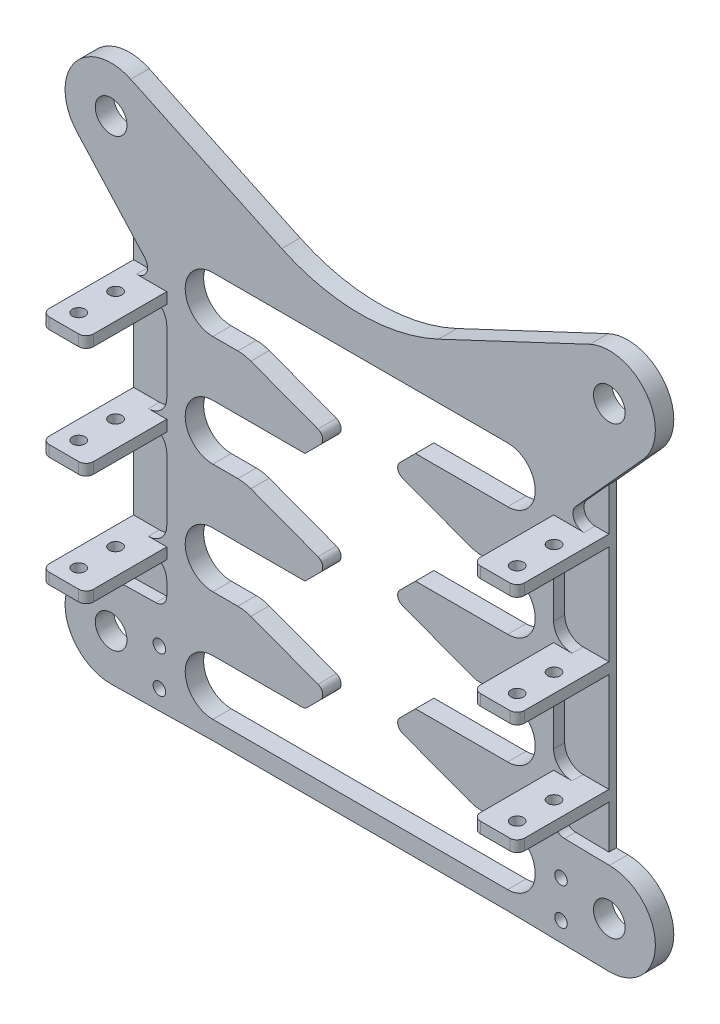
from build123d import *

# Parameters (mm, degrees)
SKETCH2_W               = 5
SKETCH2_H               = 5
BOSS_EXTRUDE2_DEPTH     = 5
CHAMFER1_SIZE           = 7.5
CHAMFER2_SIZE           = 5
FILLET2_R               = 1.5
SKETCH3_R               = 12.5
SKETCH3_R_2             = 4.3
BOSS_EXTRUDE3_DEPTH     = 5
FILLET3_R               = 50
BOSS_EXTRUDE4_DEPTH     = 5
BOSS_EXTRUDE5_START     = -5
BOSS_EXTRUDE5_DEPTH     = 5
SKETCH7_W               = 1
SKETCH7_H               = 1
BOSS_EXTRUDE6_DEPTH     = 5
SKETCH8_R               = 1.7
CUT_EXTRUDE1_DEPTH      = 10
SKETCH9_R               = 1.7
CUT_EXTRUDE2_DEPTH      = 10
CUT_EXTRUDE3_DEPTH      = 10
FILLET4_R               = 10
FILLET5_R               = 2
SKETCH12_W              = 26.9
SKETCH12_H              = 3
BOSS_EXTRUDE7_DEPTH     = 12
SKETCH13_W              = 2
SKETCH13_H              = 74.806601718
BOSS_EXTRUDE8_DEPTH     = 12
SKETCH14_W              = 10.537414104
SKETCH14_H              = 2
BOSS_EXTRUDE9_DEPTH     = 20
FILLET6_R               = 3
FILLET7_R               = 5
CUT_EXTRUDE4_DEPTH      = 155.693359215
CUT_EXTRUDE4_DEPTH_BACK = 155.693359215
SKETCH15_R              = 1.7
SKETCH16_W              = 2
SKETCH16_H              = 25.319284644
SKETCH16_H_2            = 27
SKETCH16_H_3            = 11.529384317
SKETCH16_H_4            = 3
SKETCH16_W_2            = 3
SKETCH16_W_3            = 21.9
SKETCH16_H_5            = 1.383773351
SKETCH16_H_6            = 1.616226649
BOSS_EXTRUDE13_DEPTH    = 12
SKETCH17_W              = 12
SKETCH17_H              = 2
BOSS_EXTRUDE14_DEPTH    = 2
FILLET8_R               = 5
FILLET9_R               = 3
CUT_EXTRUDE5_DEPTH      = 155.693359215
CUT_EXTRUDE5_DEPTH_BACK = 155.693359215
SKETCH19_R              = 1.7
FILLET10_R              = 2
CUT_EXTRUDE6_DEPTH      = 158.435862622
CUT_EXTRUDE6_DEPTH_BACK = 158.435862622
SKETCH20_W              = 1
SKETCH20_H              = 5


# Some blends are built 0.0001 mm under size
with BuildPart() as part:
    # Sketch2 → Boss-Extrude2 (new body)
    with BuildSketch(Plane.XY.offset(60)):
        with BuildLine():
            Line((12.5, 74.5), (12.5, 69.5))
            Line((12.5, 69.5), (40, 69.5))
            ThreePointArc((40, 69.5), (52.5, 82), (40, 94.5))
            Line((40, 94.5), (-6e-08, 94.5))
            ThreePointArc((-6e-08, 94.5), (5.590169917, 93.180339901), (10, 89.5))
            Line((10, 89.5), (40, 89.5))
            ThreePointArc((40, 89.5), (47.5, 82), (40, 74.5))
            Line((40, 74.5), (12.5, 74.5))
        make_face()
        with BuildLine():
            Line((40, 44.5), (12.5, 44.5))
            Line((12.5, 44.5), (12.5, 39.5))
            Line((12.5, 39.5), (40, 39.5))
            ThreePointArc((40, 39.5), (52.5, 52), (40, 64.5))
            Line((40, 64.5), (12.5, 64.5))
            Line((12.5, 64.5), (12.5, 59.5))
            Line((12.5, 59.5), (40, 59.5))
            ThreePointArc((40, 59.5), (47.5, 52), (40, 44.5))
        make_face()
        with BuildLine():
            Line((40, 34.5), (12.5, 34.5))
            Line((12.5, 34.5), (12.5, 29.5))
            Line((12.5, 29.5), (40, 29.5))
            ThreePointArc((40, 29.5), (47.5, 22), (40, 14.5))
            Line((40, 14.5), (12.5, 14.5))
            Line((12.5, 14.5), (12.5, 9.5))
            Line((12.5, 9.5), (40, 9.5))
            ThreePointArc((40, 9.5), (52.5, 22), (40, 34.5))
        make_face()
        with BuildLine():
            Line((40, 4.5), (12.5, 4.5))
            Line((12.5, 4.5), (12.5, -0.5))
            Line((12.5, -0.5), (40, -0.5))
            ThreePointArc((40, -0.5), (47.5, -8), (40, -15.5))
            Line((40, -15.5), (10, -15.5))
            ThreePointArc((10, -15.5), (5.590169951, -19.180339884), (1.6e-08, -20.5))
            Line((1.6e-08, -20.5), (40, -20.5))
            ThreePointArc((40, -20.5), (52.5, -8), (40, 4.5))
        make_face()
        with Locations((10, 2)):
            Rectangle(SKETCH2_W, SKETCH2_H)
        with Locations((10, 7)):
            Rectangle(SKETCH2_W, SKETCH2_H)
        with Locations((10, 12)):
            Rectangle(SKETCH2_W, SKETCH2_H)
        with Locations((10, 32)):
            Rectangle(SKETCH2_W, SKETCH2_H)
        with Locations((10, 37)):
            Rectangle(SKETCH2_W, SKETCH2_H)
        with Locations((10, 42)):
            Rectangle(SKETCH2_W, SKETCH2_H)
        with Locations((10, 62)):
            Rectangle(SKETCH2_W, SKETCH2_H)
        with Locations((10, 67)):
            Rectangle(SKETCH2_W, SKETCH2_H)
        with Locations((10, 72)):
            Rectangle(SKETCH2_W, SKETCH2_H)
        with BuildLine():
            Line((-10, 89.5), (9.8e-08, 89.5))
            Line((9.8e-08, 89.5), (10, 89.5))
            ThreePointArc((10, 89.5), (5.590169917, 93.180339901), (-6e-08, 94.5))
            ThreePointArc((-6e-08, 94.5), (-5.59016997, 93.180339874), (-10, 89.5))
        make_face()
        with BuildLine():
            Line((1.6e-08, -15.5), (-10, -15.5))
            ThreePointArc((-10, -15.5), (-5.590169937, -19.180339891), (1.6e-08, -20.5))
            ThreePointArc((1.6e-08, -20.5), (5.590169951, -19.180339884), (10, -15.5))
            Line((10, -15.5), (1.6e-08, -15.5))
        make_face()
        with BuildLine():
            Line((-12.5, -0.5), (-12.5, 4.5))
            Line((-12.5, 4.5), (-40, 4.5))
            ThreePointArc((-40, 4.5), (-52.5, -8), (-40, -20.5))
            Line((-40, -20.5), (1.6e-08, -20.5))
            ThreePointArc((1.6e-08, -20.5), (-5.590169937, -19.180339891), (-10, -15.5))
            Line((-10, -15.5), (-40, -15.5))
            ThreePointArc((-40, -15.5), (-47.5, -8), (-40, -0.5))
            Line((-40, -0.5), (-12.5, -0.5))
        make_face()
        with Locations((-10, 2)):
            Rectangle(SKETCH2_W, SKETCH2_H)
        with Locations((-10, 7)):
            Rectangle(SKETCH2_W, SKETCH2_H)
        with Locations((-10, 12)):
            Rectangle(SKETCH2_W, SKETCH2_H)
        with BuildLine():
            Line((-12.5, 29.5), (-12.5, 34.5))
            Line((-12.5, 34.5), (-40, 34.5))
            ThreePointArc((-40, 34.5), (-52.5, 22), (-40, 9.5))
            Line((-40, 9.5), (-12.5, 9.5))
            Line((-12.5, 9.5), (-12.5, 14.5))
            Line((-12.5, 14.5), (-40, 14.5))
            ThreePointArc((-40, 14.5), (-47.5, 22), (-40, 29.5))
            Line((-40, 29.5), (-12.5, 29.5))
        make_face()
        with Locations((-10, 32)):
            Rectangle(SKETCH2_W, SKETCH2_H)
        with Locations((-10, 37)):
            Rectangle(SKETCH2_W, SKETCH2_H)
        with Locations((-10, 42)):
            Rectangle(SKETCH2_W, SKETCH2_H)
        with BuildLine():
            Line((-12.5, 39.5), (-12.5, 44.5))
            Line((-12.5, 44.5), (-40, 44.5))
            ThreePointArc((-40, 44.5), (-47.5, 52), (-40, 59.5))
            Line((-40, 59.5), (-12.5, 59.5))
            Line((-12.5, 59.5), (-12.5, 64.5))
            Line((-12.5, 64.5), (-40, 64.5))
            ThreePointArc((-40, 64.5), (-52.5, 52), (-40, 39.5))
            Line((-40, 39.5), (-12.5, 39.5))
        make_face()
        with Locations((-10, 62)):
            Rectangle(SKETCH2_W, SKETCH2_H)
        with Locations((-10, 67)):
            Rectangle(SKETCH2_W, SKETCH2_H)
        with Locations((-10, 72)):
            Rectangle(SKETCH2_W, SKETCH2_H)
        with BuildLine():
            Line((-40, 69.5), (-12.5, 69.5))
            Line((-12.5, 69.5), (-12.5, 74.5))
            Line((-12.5, 74.5), (-40, 74.5))
            ThreePointArc((-40, 74.5), (-47.5, 82), (-40, 89.5))
            Line((-40, 89.5), (-10, 89.5))
            ThreePointArc((-10, 89.5), (-5.59016997, 93.180339874), (-6e-08, 94.5))
            Line((-6e-08, 94.5), (-40, 94.5))
            ThreePointArc((-40, 94.5), (-52.5, 82), (-40, 69.5))
        make_face()
    extrude(amount=BOSS_EXTRUDE2_DEPTH)

    # Chamfer1
    chamfer1_edges = [part.edges().sort_by_distance(p)[0] for p in [
        (7.5, 44.5, 62.5),
        (-7.5, 44.5, 62.5),
        (-7.5, 14.5, 62.5),
        (7.5, 14.5, 62.5),
        (-7.5, 29.5, 62.5),
        (-7.5, -0.5, 62.5),
        (7.5, -0.5, 62.5),
        (7.5, 29.5, 62.5),
        (-7.5, 74.5, 62.5),
        (-7.5, 59.5, 62.5),
        (7.5, 74.5, 62.5),
        (7.5, 59.5, 62.5),
    ]]
    chamfer(chamfer1_edges, length=CHAMFER1_SIZE - 0.0001)  # a hair under: the kernel refuses the full size

    # Chamfer2
    # the kernel refuses this chamfer: 5 mm, written as the material it adds along each edge
    with BuildSketch(Plane(origin=(12.5, 64.5, 60), x_dir=(0.9996219169112968, -0.0274958766105877, 0), z_dir=(0, 0, 1)), Plane(origin=(12.5, 69.5, 60), x_dir=(-0.027495876610586282, -0.9996219169112968, 0), z_dir=(0, 0, 1)), Plane(origin=(12.5, 34.5, 60), x_dir=(0.9996219169112968, -0.027495876610586317, 0), z_dir=(0, 0, 1)), Plane(origin=(12.5, 39.5, 60), x_dir=(-0.027495876610586317, -0.9996219169112968, 0), z_dir=(0, 0, 1)), Plane(origin=(-12.5, 64.5, 60), x_dir=(0.027495876610586282, 0.9996219169112968, 0), z_dir=(0, 0, 1)), Plane(origin=(-12.5, 69.5, 60), x_dir=(-0.9996219169112965, 0.02749587661059046, 0), z_dir=(0, 0, 1)), Plane(origin=(-12.5, 39.5, 60), x_dir=(-0.9996219169112968, 0.027495876610586317, 0), z_dir=(0, 0, 1)), Plane(origin=(-12.5, 34.5, 60), x_dir=(0.027495876610586317, 0.9996219169112968, 0), z_dir=(0, 0, 1)), Plane(origin=(-12.5, 4.5, 60), x_dir=(0.027495876610586317, 0.9996219169112968, 0), z_dir=(0, 0, 1)), Plane(origin=(-12.5, 9.5, 60), x_dir=(-0.9996219169112968, 0.027495876610585973, 0), z_dir=(0, 0, 1)), Plane(origin=(12.5, 9.5, 60), x_dir=(-0.027495876610586317, -0.9996219169112968, 0), z_dir=(0, 0, 1)), Plane(origin=(12.5, 4.5, 60), x_dir=(0.9996219169112968, -0.027495876610586147, 0), z_dir=(0, 0, 1))) as chamfer2_piece_1:
        Polygon((CHAMFER2_SIZE * 0.999621916911, CHAMFER2_SIZE * 0.0274958766106), (-CHAMFER2_SIZE * 0.0274958766106, CHAMFER2_SIZE * 0.999621916911), (0, 0), align=None)
    extrude(amount=5)

    # Fillet2
    fillet2_edges = [part.edges().sort_by_distance(p)[0] for p in [
        (17.5, 64.5, 62.5),
        (17.5, 69.5, 62.5),
        (17.5, 34.5, 62.5),
        (17.5, 39.5, 62.5),
        (-17.5, 64.5, 62.5),
        (-17.5, 69.5, 62.5),
        (-17.5, 39.5, 62.5),
        (-17.5, 34.5, 62.5),
        (-17.5, 4.5, 62.5),
        (-17.5, 9.5, 62.5),
        (17.5, 9.5, 62.5),
        (17.5, 4.5, 62.5),
        (15, 67, 62.5),
        (15, 37, 62.5),
        (-15, 67, 62.5),
        (-15, 37, 62.5),
        (-15, 7, 62.5),
        (15, 7, 62.5),
    ]]
    fillet(fillet2_edges, radius=FILLET2_R)

    # Sketch3 → Boss-Extrude3 (add)
    # profile 1 of 8: a face of its own
    with BuildSketch(Plane(origin=(0, 0, 60), x_dir=(-1, 0, 0), z_dir=(0, 0, -1))):
        with BuildLine():
            Line((0, 94.5), (-62.283149796, 123.816370046))
            ThreePointArc((-62.283149796, 123.816370046), (-57.052144152, 119.203871721), (-55.106601718, 112.506601718))
            ThreePointArc((-55.106601718, 112.506601718), (-63.112426598, 100.842451942), (-76.874984117, 104.119284644))
            Line((-76.874984117, 104.119284644), (-49.268382399, 73.612682926))
            ThreePointArc((-49.268382399, 73.612682926), (-51.425661106, 87.0699377), (-40, 94.5))
            Line((-40, 94.5), (0, 94.5))
        make_face()
    # profile 2 of 8: a face of its own
    with BuildSketch(Plane(origin=(0, 0, 60), x_dir=(-1, 0, 0), z_dir=(0, 0, -1))):
        with Locations((-67.606601718, 112.506601718)):
            Circle(SKETCH3_R)
        with Locations((-67.606601718, 112.506601718)):
            Circle(SKETCH3_R_2, mode=Mode.SUBTRACT)
    # profile 3 of 8: a face of its own
    with BuildSketch(Plane(origin=(0, 0, 60), x_dir=(-1, 0, 0), z_dir=(0, 0, -1))):
        with BuildLine():
            Line((62.283149796, 123.816370046), (0, 94.5))
            Line((0, 94.5), (40, 94.5))
            ThreePointArc((40, 94.5), (51.425661106, 87.0699377), (49.268382399, 73.612682926))
            Line((49.268382399, 73.612682926), (76.874984117, 104.119284644))
            ThreePointArc((76.874984117, 104.119284644), (57.562478438, 105.065796147), (62.283149796, 123.816370046))
        make_face()
    # profile 4 of 8: a face of its own
    with BuildSketch(Plane(origin=(0, 0, 60), x_dir=(-1, 0, 0), z_dir=(0, 0, -1))):
        with Locations((67.606601718, 112.506601718)):
            Circle(SKETCH3_R)
        with Locations((67.606601718, 112.506601718)):
            Circle(SKETCH3_R_2, mode=Mode.SUBTRACT)
    # profile 5 of 8: a face of its own
    with BuildSketch(Plane(origin=(0, 0, 60), x_dir=(-1, 0, 0), z_dir=(0, 0, -1))):
        with BuildLine():
            Line((67.147987523, -20.998185805), (67.606601718, -21.006601718))
            ThreePointArc((67.606601718, -21.006601718), (76.445436483, -17.345436483), (80.106601718, -8.506601718))
            ThreePointArc((80.106601718, -8.506601718), (76.445436483, 0.332233047), (67.606601718, 3.993398282))
            ThreePointArc((67.606601718, 3.993398282), (55.108705873, -8.277256014), (67.147987523, -20.998185805))
        make_face()
        with Locations((67.606601718, -8.506601718)):
            Circle(SKETCH3_R_2, mode=Mode.SUBTRACT)
    # profile 6 of 8: a face of its own
    with BuildSketch(Plane(origin=(0, 0, 60), x_dir=(-1, 0, 0), z_dir=(0, 0, -1))):
        with BuildLine():
            Line((40, -20.5), (67.147987523, -20.998185805))
            ThreePointArc((67.147987523, -20.998185805), (55.108705873, -8.277256014), (67.606601718, 3.993398282))
            Line((67.606601718, 3.993398282), (40.458614195, 4.491584088))
            ThreePointArc((40.458614195, 4.491584088), (52.497895845, -8.229345704), (40, -20.5))
        make_face()
    # profile 7 of 8: a face of its own
    with BuildSketch(Plane(origin=(0, 0, 60), x_dir=(-1, 0, 0), z_dir=(0, 0, -1))):
        with BuildLine():
            ThreePointArc((-67.606601718, 3.993398282), (-80.106601718, -8.506601718), (-67.606601718, -21.006601718))
            Line((-67.606601718, -21.006601718), (-67.147987523, -20.998185805))
            ThreePointArc((-67.147987523, -20.998185805), (-58.607082913, -17.181776718), (-55.106601718, -8.506601718))
            ThreePointArc((-55.106601718, -8.506601718), (-58.767766953, 0.332233047), (-67.606601718, 3.993398282))
        make_face()
        with Locations((-67.606601718, -8.506601718)):
            Circle(SKETCH3_R_2, mode=Mode.SUBTRACT)
    # profile 8 of 8: a face of its own
    with BuildSketch(Plane(origin=(0, 0, 60), x_dir=(-1, 0, 0), z_dir=(0, 0, -1))):
        with BuildLine():
            ThreePointArc((-55.106601718, -8.506601718), (-58.607082913, -17.181776718), (-67.147987523, -20.998185805))
            Line((-67.147987523, -20.998185805), (-40, -20.5))
            ThreePointArc((-40, -20.5), (-52.497895845, -8.229345704), (-40.458614195, 4.491584088))
            Line((-40.458614195, 4.491584088), (-67.606601718, 3.993398282))
            ThreePointArc((-67.606601718, 3.993398282), (-58.767766953, 0.332233047), (-55.106601718, -8.506601718))
        make_face()
    extrude(amount=-BOSS_EXTRUDE3_DEPTH)

    # Fillet3
    fillet3_edges = [part.edges().sort_by_distance(p)[0] for p in [
        (0, 94.5, 62.5),
    ]]
    fillet(fillet3_edges, radius=FILLET3_R)

    # Sketch4 → Boss-Extrude4 (add)
    with BuildSketch(Plane.XY.offset(65)):
        with BuildLine():
            Line((-16.060660172, 8.060660172), (-17.060660172, 9.060660172))
            ThreePointArc((-17.060660172, 9.060660172), (-17.547295195, 9.385819299), (-18.121320344, 9.5))
            Line((-18.121320344, 9.5), (-40, 9.5))
            ThreePointArc((-40, 9.5), (-48.838834765, 13.161165235), (-52.5, 22))
            Line((-52.5, 22), (-52.5, 4.270615683))
            Line((-52.5, 4.270615683), (-40.458614195, 4.491584088))
            ThreePointArc((-40.458614195, 4.491584088), (-40.229345704, 4.497895845), (-40, 4.5))
            Line((-40, 4.5), (-18.121320344, 4.5))
            ThreePointArc((-18.121320344, 4.5), (-17.547295195, 4.614180701), (-17.060660172, 4.939339828))
            Line((-17.060660172, 4.939339828), (-16.060660172, 5.939339828))
            ThreePointArc((-16.060660172, 5.939339828), (-15.621320344, 7), (-16.060660172, 8.060660172))
        make_face()
        with BuildLine():
            Line((-52.5, 52), (-52.5, 22))
            ThreePointArc((-52.5, 22), (-48.838834765, 30.838834765), (-40, 34.5))
            Line((-40, 34.5), (-18.121320344, 34.5))
            ThreePointArc((-18.121320344, 34.5), (-17.547295195, 34.614180701), (-17.060660172, 34.939339828))
            Line((-17.060660172, 34.939339828), (-16.060660172, 35.939339828))
            ThreePointArc((-16.060660172, 35.939339828), (-15.621320344, 37), (-16.060660172, 38.060660172))
            Line((-16.060660172, 38.060660172), (-17.060660172, 39.060660172))
            ThreePointArc((-17.060660172, 39.060660172), (-17.547295195, 39.385819299), (-18.121320344, 39.5))
            Line((-18.121320344, 39.5), (-40, 39.5))
            ThreePointArc((-40, 39.5), (-48.838834765, 43.161165235), (-52.5, 52))
        make_face()
        with BuildLine():
            Line((-52.5, 77.183773351), (-52.5, 52))
            ThreePointArc((-52.5, 52), (-48.838834765, 60.838834765), (-40, 64.5))
            Line((-40, 64.5), (-18.121320344, 64.5))
            ThreePointArc((-18.121320344, 64.5), (-17.547295195, 64.614180701), (-17.060660172, 64.939339828))
            Line((-17.060660172, 64.939339828), (-16.060660172, 65.939339828))
            ThreePointArc((-16.060660172, 65.939339828), (-15.621320344, 67), (-16.060660172, 68.060660172))
            Line((-16.060660172, 68.060660172), (-17.060660172, 69.060660172))
            ThreePointArc((-17.060660172, 69.060660172), (-17.547295195, 69.385819299), (-18.121320344, 69.5))
            Line((-18.121320344, 69.5), (-40, 69.5))
            ThreePointArc((-40, 69.5), (-45.0699377, 70.574338894), (-49.268382399, 73.612682926))
            Line((-49.268382399, 73.612682926), (-52.5, 77.183773351))
        make_face()
    extrude(amount=-BOSS_EXTRUDE4_DEPTH)

    # Sketch5 → Boss-Extrude5 (add)
    with BuildSketch(Plane.XY.offset(65).offset(BOSS_EXTRUDE5_START)):
        with BuildLine():
            ThreePointArc((40, 64.5), (48.838834765, 60.838834765), (52.5, 52))
            Line((52.5, 52), (52.5, 77.183773351))
            Line((52.5, 77.183773351), (49.268382399, 73.612682926))
            ThreePointArc((49.268382399, 73.612682926), (45.0699377, 70.574338894), (40, 69.5))
            Line((40, 69.5), (18.121320344, 69.5))
            ThreePointArc((18.121320344, 69.5), (17.547295195, 69.385819299), (17.060660172, 69.060660172))
            Line((17.060660172, 69.060660172), (16.060660172, 68.060660172))
            ThreePointArc((16.060660172, 68.060660172), (15.621320344, 67), (16.060660172, 65.939339828))
            Line((16.060660172, 65.939339828), (17.060660172, 64.939339828))
            ThreePointArc((17.060660172, 64.939339828), (17.547295195, 64.614180701), (18.121320344, 64.5))
            Line((18.121320344, 64.5), (40, 64.5))
        make_face()
        with BuildLine():
            ThreePointArc((40, 34.5), (48.838834765, 30.838834765), (52.5, 22))
            Line((52.5, 22), (52.5, 52))
            ThreePointArc((52.5, 52), (48.838834765, 43.161165235), (40, 39.5))
            Line((40, 39.5), (18.121320344, 39.5))
            ThreePointArc((18.121320344, 39.5), (17.547295195, 39.385819299), (17.060660172, 39.060660172))
            Line((17.060660172, 39.060660172), (16.060660172, 38.060660172))
            ThreePointArc((16.060660172, 38.060660172), (15.621320344, 37), (16.060660172, 35.939339828))
            Line((16.060660172, 35.939339828), (17.060660172, 34.939339828))
            ThreePointArc((17.060660172, 34.939339828), (17.547295195, 34.614180701), (18.121320344, 34.5))
            Line((18.121320344, 34.5), (40, 34.5))
        make_face()
        with BuildLine():
            Line((40.458614195, 4.491584088), (52.5, 4.270615683))
            Line((52.5, 4.270615683), (52.5, 22))
            ThreePointArc((52.5, 22), (48.838834765, 13.161165235), (40, 9.5))
            Line((40, 9.5), (18.121320344, 9.5))
            ThreePointArc((18.121320344, 9.5), (17.547295195, 9.385819299), (17.060660172, 9.060660172))
            Line((17.060660172, 9.060660172), (16.060660172, 8.060660172))
            ThreePointArc((16.060660172, 8.060660172), (15.621320344, 7), (16.060660172, 5.939339828))
            Line((16.060660172, 5.939339828), (17.060660172, 4.939339828))
            ThreePointArc((17.060660172, 4.939339828), (17.547295195, 4.614180701), (18.121320344, 4.5))
            Line((18.121320344, 4.5), (40, 4.5))
            ThreePointArc((40, 4.5), (40.229345704, 4.497895845), (40.458614195, 4.491584088))
        make_face()
    extrude(amount=BOSS_EXTRUDE5_DEPTH)

    # Sketch7 → Boss-Extrude6 (add)
    with BuildSketch(Plane.XY.offset(65)):
        with Locations((48, 82.5)):
            Rectangle(SKETCH7_W, SKETCH7_H)
        with Locations((48, 81.5)):
            Rectangle(SKETCH7_W, SKETCH7_H)
        with Locations((48, 52.5)):
            Rectangle(SKETCH7_W, SKETCH7_H)
        with Locations((48, 51.5)):
            Rectangle(SKETCH7_W, SKETCH7_H)
        with Locations((48, 22.5)):
            Rectangle(SKETCH7_W, SKETCH7_H)
        with Locations((48, 21.5)):
            Rectangle(SKETCH7_W, SKETCH7_H)
        with Locations((48, -7.5)):
            Rectangle(SKETCH7_W, SKETCH7_H)
        with Locations((48, -8.5)):
            Rectangle(SKETCH7_W, SKETCH7_H)
        with Locations((-48, -7.5)):
            Rectangle(SKETCH7_W, SKETCH7_H)
        with Locations((-48, -8.5)):
            Rectangle(SKETCH7_W, SKETCH7_H)
        with Locations((-48, 22.5)):
            Rectangle(SKETCH7_W, SKETCH7_H)
        with Locations((-48, 21.5)):
            Rectangle(SKETCH7_W, SKETCH7_H)
        with Locations((-48, 52.5)):
            Rectangle(SKETCH7_W, SKETCH7_H)
        with Locations((-48, 51.5)):
            Rectangle(SKETCH7_W, SKETCH7_H)
        with Locations((-48, 82.5)):
            Rectangle(SKETCH7_W, SKETCH7_H)
        with Locations((-48, 81.5)):
            Rectangle(SKETCH7_W, SKETCH7_H)
    extrude(amount=BOSS_EXTRUDE6_DEPTH)

    # Sketch8 → Cut-Extrude1 (cut)
    with BuildSketch(Plane.XY.offset(65)):
        with Locations((-54.5, -5.5)):
            Circle(SKETCH8_R)
        with Locations((-54.5, -15.5)):
            Circle(SKETCH8_R)
    extrude(amount=-CUT_EXTRUDE1_DEPTH, mode=Mode.SUBTRACT)

    # Sketch9 → Cut-Extrude2 (cut)
    with BuildSketch(Plane.XY.offset(65)):
        with Locations((54.5, -5.5)):
            Circle(SKETCH9_R)
        with Locations((54.5, -15.5)):
            Circle(SKETCH9_R)
    extrude(amount=-CUT_EXTRUDE2_DEPTH, mode=Mode.SUBTRACT)

    # Sketch10 → Cut-Extrude3 (cut)
    with BuildSketch(Plane.XY.offset(65)):
        with BuildLine():
            ThreePointArc((-36, 82), (-36.0641858, 81.286300778), (-36.25468329, 80.595506234))
            Line((-36.25468329, 80.595506234), (36.25468329, 53.404493766))
            ThreePointArc((36.25468329, 53.404493766), (38.344788223, 55.64146591), (41.404493766, 55.74531671))
            Line((41.404493766, 55.74531671), (-38.595506234, 85.74531671))
            ThreePointArc((-38.595506234, 85.74531671), (-36.71229753, 84.278379351), (-36, 82))
        make_face()
        with BuildLine():
            Line((36.25468329, 53.404493766), (-36.25468329, 80.595506234))
            ThreePointArc((-36.25468329, 80.595506234), (-38.344788223, 78.35853409), (-41.404493766, 78.25468329))
            Line((-41.404493766, 78.25468329), (38.595506234, 48.25468329))
            ThreePointArc((38.595506234, 48.25468329), (36.35853409, 50.344788223), (36.25468329, 53.404493766))
        make_face()
        with BuildLine():
            Line((-20, 74.5), (-36.25468329, 80.595506234))
            ThreePointArc((-36.25468329, 80.595506234), (-38.344788223, 78.35853409), (-41.404493766, 78.25468329))
            Line((-41.404493766, 78.25468329), (-31.392004994, 74.5))
            Line((-31.392004994, 74.5), (-20, 74.5))
        make_face()
        with BuildLine():
            Line((31.392004994, 59.5), (20, 59.5))
            Line((20, 59.5), (36.25468329, 53.404493766))
            ThreePointArc((36.25468329, 53.404493766), (38.344788223, 55.64146591), (41.404493766, 55.74531671))
            Line((41.404493766, 55.74531671), (31.392004994, 59.5))
        make_face()
        with BuildLine():
            ThreePointArc((-36, 52), (-36.0641858, 51.286300778), (-36.25468329, 50.595506234))
            Line((-36.25468329, 50.595506234), (36.25468329, 23.404493766))
            ThreePointArc((36.25468329, 23.404493766), (38.344788223, 25.64146591), (41.404493766, 25.74531671))
            Line((41.404493766, 25.74531671), (-38.595506234, 55.74531671))
            ThreePointArc((-38.595506234, 55.74531671), (-36.71229753, 54.278379351), (-36, 52))
        make_face()
        with BuildLine():
            Line((36.25468329, 23.404493766), (-36.25468329, 50.595506234))
            ThreePointArc((-36.25468329, 50.595506234), (-38.344788223, 48.35853409), (-41.404493766, 48.25468329))
            Line((-41.404493766, 48.25468329), (38.595506234, 18.25468329))
            ThreePointArc((38.595506234, 18.25468329), (36.35853409, 20.344788223), (36.25468329, 23.404493766))
        make_face()
        with BuildLine():
            Line((-41.404493766, 48.25468329), (-31.392004994, 44.5))
            Line((-31.392004994, 44.5), (-20, 44.5))
            Line((-20, 44.5), (-36.25468329, 50.595506234))
            ThreePointArc((-36.25468329, 50.595506234), (-38.344788223, 48.35853409), (-41.404493766, 48.25468329))
        make_face()
        with BuildLine():
            Line((41.404493766, 25.74531671), (31.392004994, 29.5))
            Line((31.392004994, 29.5), (20, 29.5))
            Line((20, 29.5), (36.25468329, 23.404493766))
            ThreePointArc((36.25468329, 23.404493766), (38.344788223, 25.64146591), (41.404493766, 25.74531671))
        make_face()
        with BuildLine():
            Line((36.25468329, -6.595506234), (-36.25468329, 20.595506234))
            ThreePointArc((-36.25468329, 20.595506234), (-38.344788223, 18.35853409), (-41.404493766, 18.25468329))
            Line((-41.404493766, 18.25468329), (38.595506234, -11.74531671))
            ThreePointArc((38.595506234, -11.74531671), (36.35853409, -9.655211777), (36.25468329, -6.595506234))
        make_face()
        with BuildLine():
            ThreePointArc((-36, 22), (-36.0641858, 21.286300778), (-36.25468329, 20.595506234))
            Line((-36.25468329, 20.595506234), (36.25468329, -6.595506234))
            ThreePointArc((36.25468329, -6.595506234), (38.344788223, -4.35853409), (41.404493766, -4.25468329))
            Line((41.404493766, -4.25468329), (-38.595506234, 25.74531671))
            ThreePointArc((-38.595506234, 25.74531671), (-36.71229753, 24.278379351), (-36, 22))
        make_face()
        with BuildLine():
            Line((-41.404493766, 18.25468329), (-31.392004994, 14.5))
            Line((-31.392004994, 14.5), (-20, 14.5))
            Line((-20, 14.5), (-36.25468329, 20.595506234))
            ThreePointArc((-36.25468329, 20.595506234), (-38.344788223, 18.35853409), (-41.404493766, 18.25468329))
        make_face()
    extrude(amount=-CUT_EXTRUDE3_DEPTH, mode=Mode.SUBTRACT)

    # Fillet4
    fillet4_edges = [part.edges().sort_by_distance(p)[0] for p in [
        (-31.392004994, 44.5, 62.5),
        (-31.392004994, 14.5, 62.5),
        (31.392004994, -0.5, 62.5),
        (-31.392004994, 74.5, 62.5),
        (31.392004994, 59.5, 62.5),
    ]]
    fillet(fillet4_edges, radius=FILLET4_R)

    # Fillet5
    fillet5_edges = [part.edges().sort_by_distance(p)[0] for p in [
        (8.56138318, 68.06148318, 62.5),
        (-8.56138318, 65.93851682, 62.5),
        (8.56138318, 8.06148318, 62.5),
        (-8.56138318, 5.93851682, 62.5),
        (-8.56138318, 35.93851682, 62.5),
        (8.56138318, 38.06148318, 62.5),
        (-14.9999, -0.5, 62.5),
    ]]
    fillet(fillet5_edges, radius=FILLET5_R)

    # Sketch12 → Boss-Extrude7 (add)
    with BuildSketch(Plane.ZY.offset(52.5)):
        Polygon((65, 48.8), (86.9, 48.8), (86.9, 45.8), (60, 45.8), (60, 48.8), align=None)
        with Locations((73.45, 17.3)):
            Rectangle(SKETCH12_W, SKETCH12_H)
        with Locations((73.45, 77.3)):
            Rectangle(SKETCH12_W, SKETCH12_H)
    extrude(amount=BOSS_EXTRUDE7_DEPTH)

    # Sketch13 → Boss-Extrude8 (add)
    with BuildSketch(Plane.ZY.offset(52.5)):
        with Locations((61, 41.396699141)):
            Rectangle(SKETCH13_W, SKETCH13_H)
    extrude(amount=BOSS_EXTRUDE8_DEPTH)

    # Sketch14 → Boss-Extrude9 (add)
    with BuildSketch(Plane(origin=(0, 78.8, 0), x_dir=(1, 0, 0), z_dir=(0, 1, 0))):
        with Locations((-59.231292948, -61)):
            Rectangle(SKETCH14_W, SKETCH14_H)
    extrude(amount=BOSS_EXTRUDE9_DEPTH)

    # Fillet6
    fillet6_edges = [part.edges().sort_by_distance(p)[0] for p in [
        (-53.962585896, 78.8, 63.5),
        (-52.5, 4.270615683, 63.5),
    ]]
    fillet(fillet6_edges, radius=FILLET6_R)

    # Fillet7
    fillet7_edges = [part.edges().sort_by_distance(p)[0] for p in [
        (-52.5, 18.8, 63.5),
        (-52.5, 75.8, 63.5),
        (-52.5, 15.8, 63.5),
        (-52.5, 48.8, 63.5),
        (-52.5, 45.8, 63.5),
    ]]
    fillet(fillet7_edges, radius=FILLET7_R)

    # Sketch15 → Cut-Extrude4 (cut, two sides: drawn at the far end of the back side and taken through both)
    with BuildSketch(Plane(origin=(0, 78.8, 0), x_dir=(1, 0, 0), z_dir=(0, 1, 0)).offset(-CUT_EXTRUDE4_DEPTH_BACK)):
        with Locations(Location((-59.5, -81.9, 0), (0, 0, 270))):
            Circle(SKETCH15_R)
        with Locations(Location((-59.5, -71.9, 0), (0, 0, 270))):
            Circle(SKETCH15_R)
    extrude(amount=CUT_EXTRUDE4_DEPTH + CUT_EXTRUDE4_DEPTH_BACK, mode=Mode.SUBTRACT)

    # Sketch16 → Boss-Extrude13 (add)
    with BuildSketch(Plane(origin=(52.5, 0, 0), x_dir=(0, 0, -1), z_dir=(1, 0, 0))):
        with Locations((-61, 91.459642322)):
            Rectangle(SKETCH16_W, SKETCH16_H)
        with Locations((-61, 62.3)):
            Rectangle(SKETCH16_W, SKETCH16_H_2)
        with Locations((-61, 32.3)):
            Rectangle(SKETCH16_W, SKETCH16_H_2)
        with Locations((-61, 10.035307841)):
            Rectangle(SKETCH16_W, SKETCH16_H_3)
        with Locations((-61, 17.3)):
            Rectangle(SKETCH16_W, SKETCH16_H_4)
        with Locations((-63.5, 17.3)):
            Rectangle(SKETCH16_W_2, SKETCH16_H_4)
        with Locations((-75.95, 17.3)):
            Rectangle(SKETCH16_W_3, SKETCH16_H_4)
        with Locations((-75.95, 47.3)):
            Rectangle(SKETCH16_W_3, SKETCH16_H_4)
        with Locations((-63.5, 47.3)):
            Rectangle(SKETCH16_W_2, SKETCH16_H_4)
        with Locations((-61, 47.3)):
            Rectangle(SKETCH16_W, SKETCH16_H_4)
        with Locations((-61, 76.491886676)):
            Rectangle(SKETCH16_W, SKETCH16_H_5)
        with Locations((-63.5, 76.491886676)):
            Rectangle(SKETCH16_W_2, SKETCH16_H_5)
        Polygon((-86.9, 75.8), (-65, 75.8), (-65, 77.183773351), (-65, 78.8), (-86.9, 78.8), align=None)
        with Locations((-61, 77.991886676)):
            Rectangle(SKETCH16_W, SKETCH16_H_6)
        with Locations((-63.5, 77.991886676)):
            Rectangle(SKETCH16_W_2, SKETCH16_H_6)
    extrude(amount=BOSS_EXTRUDE13_DEPTH)

    # Sketch17 → Boss-Extrude14 (add)
    with BuildSketch(Plane.XZ.offset(-4.270615683)):
        with Locations((58.5, 61)):
            Rectangle(SKETCH17_W, SKETCH17_H)
    extrude(amount=BOSS_EXTRUDE14_DEPTH)

    # Fillet8
    fillet8_edges = [part.edges().sort_by_distance(p)[0] for p in [
        (52.5, 15.8, 63.5),
        (52.5, 18.8, 63.5),
        (52.5, 45.8, 63.5),
        (52.5, 48.8, 63.5),
        (52.5, 75.8, 63.5),
    ]]
    fillet(fillet8_edges, radius=FILLET8_R)

    # Fillet9
    fillet9_edges = [part.edges().sort_by_distance(p)[0] for p in [
        (52.5, 4.270615683, 63.5),
        (53.962585896, 78.8, 63.5),
    ]]
    fillet(fillet9_edges, radius=FILLET9_R)

    # Sketch19 → Cut-Extrude5 (cut, two sides: drawn at the far end of the back side and taken through both)
    with BuildSketch(Plane(origin=(0, 78.8, 0), x_dir=(1, 0, 0), z_dir=(0, 1, 0)).offset(-CUT_EXTRUDE5_DEPTH_BACK)):
        with Locations(Location((59.5, -81.9, 0), (0, 0, 270))):
            Circle(SKETCH19_R)
        with Locations(Location((59.5, -71.9, 0), (0, 0, 270))):
            Circle(SKETCH19_R)
    extrude(amount=CUT_EXTRUDE5_DEPTH + CUT_EXTRUDE5_DEPTH_BACK, mode=Mode.SUBTRACT)

    # Fillet10
    fillet10_edges = [part.edges().sort_by_distance(p)[0] for p in [
        (-52.5, 47.3, 86.9),
        (-64.5, 47.3, 86.9),
        (-52.5, 17.3, 86.9),
        (-64.5, 17.3, 86.9),
        (-52.5, 77.3, 86.9),
        (-64.5, 77.3, 86.9),
        (52.5, 17.3, 86.9),
        (52.5, 47.3, 86.9),
        (64.5, 77.3, 86.9),
        (64.5, 47.3, 86.9),
        (64.5, 17.3, 86.9),
        (52.5, 77.3, 86.9),
    ]]
    fillet(fillet10_edges, radius=FILLET10_R)

    # Sketch20 → Cut-Extrude6 (cut, two sides: drawn at the far end of the back side and taken through both)
    with BuildSketch(Plane.XZ.offset(-21).offset(-CUT_EXTRUDE6_DEPTH_BACK)):
        with Locations((-48, 67.5)):
            Rectangle(SKETCH20_W, SKETCH20_H)
        with Locations((48, 67.5)):
            Rectangle(SKETCH20_W, SKETCH20_H)
    extrude(amount=CUT_EXTRUDE6_DEPTH + CUT_EXTRUDE6_DEPTH_BACK, mode=Mode.SUBTRACT)


solid = part.part
